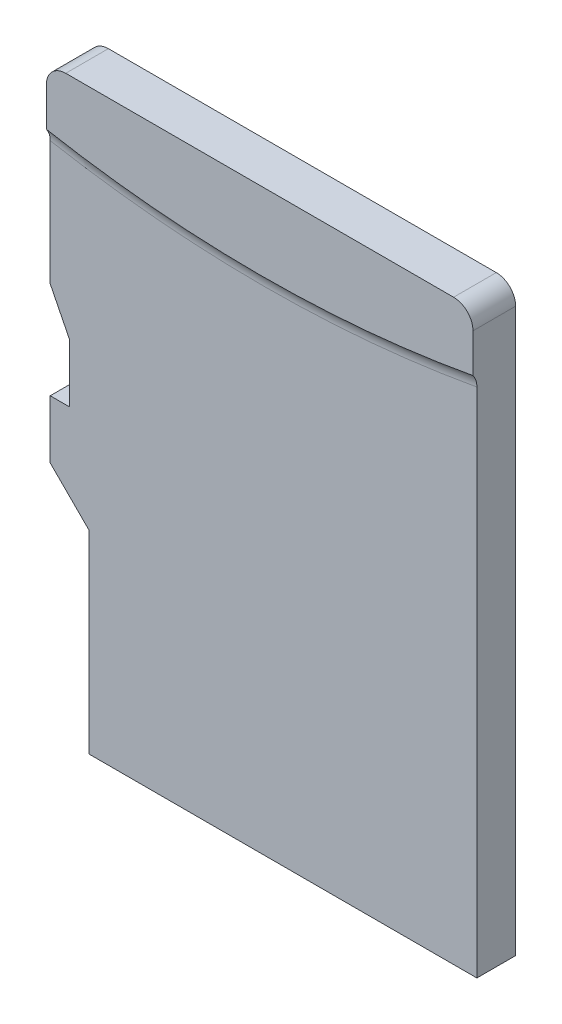
from build123d import *

# Parameters (mm, degrees)
EXTRUDE_1_DEPTH = 1
EXTRUDE_2_DEPTH = 0.1
FILLET_1_R      = 0.5
FILLET_2_R      = 0.5


with BuildPart() as part:
    # 草图1 → 凸台-拉伸1 (new body)
    with BuildSketch(Plane.XY):
        Polygon((-5, 0), (-5, 1.5), (-5.5, 2.5), (-5.5, 7.5), (5.5, 7.5), (5.5, -7.5), (-4.5, -7.5), (-4.5, -2.5), (-5.5, -1.5), (-5.5, 0), align=None)
    extrude(amount=EXTRUDE_1_DEPTH)

    # 草图2 → 凸台-拉伸2 (add)
    with BuildSketch(Plane.XY.offset(1)):
        with BuildLine():
            Line((-5.5, 6), (-5.5, 7.5))
            Line((-5.5, 7.5), (5.5, 7.5))
            Line((5.5, 7.5), (5.5, 6))
            ThreePointArc((5.5, 6), (0, 5.5), (-5.5, 6))
        make_face()
    extrude(amount=EXTRUDE_2_DEPTH)

    # 圆角1
    # the kernel refuses this fillet: 0.5 mm, written as the material it adds along each edge
    with BuildSketch(Plane(origin=(0, 36, 1), x_dir=(0.20445847585132765, -0.9788752380423933, 0), z_dir=(0.9788752380423933, 0.20445847585132765, 0))) as fillet_1_piece_1_section:
        with BuildLine():
            CenterArc((30.8, -0.5), FILLET_1_R, 90, 36.869897646)
            Line((30.5, -0.1), (30.5, 0))
            Line((30.5, 0), (30.8, 0))
        make_face()
    fillet_1_piece_1 = revolve(axis=Axis((0, 36, 1), (0, 0, -1)), revolution_arc=23.595601167, mode=Mode.PRIVATE)
    fillet_1_piece_1 = split(fillet_1_piece_1, bisect_by=Plane(origin=(-5.5, 5.358430111, 1.024709668), z_dir=(1, 0, 0)), keep=Keep.TOP, mode=Mode.PRIVATE)
    fillet_1_piece_1 = split(fillet_1_piece_1, bisect_by=Plane(origin=(5.5, 5.358430111, 1.024709668), z_dir=(-1, 0, 0)), keep=Keep.TOP, mode=Mode.PRIVATE)
    add(fillet_1_piece_1)

    # 圆角2
    fillet_2_edges = [part.edges().sort_by_distance(p)[0] for p in [
        (-5.5, 7.5, 0.55),
        (5.5, 7.5, 0.55),
    ]]
    fillet(fillet_2_edges, radius=FILLET_2_R)


solid = part.part
